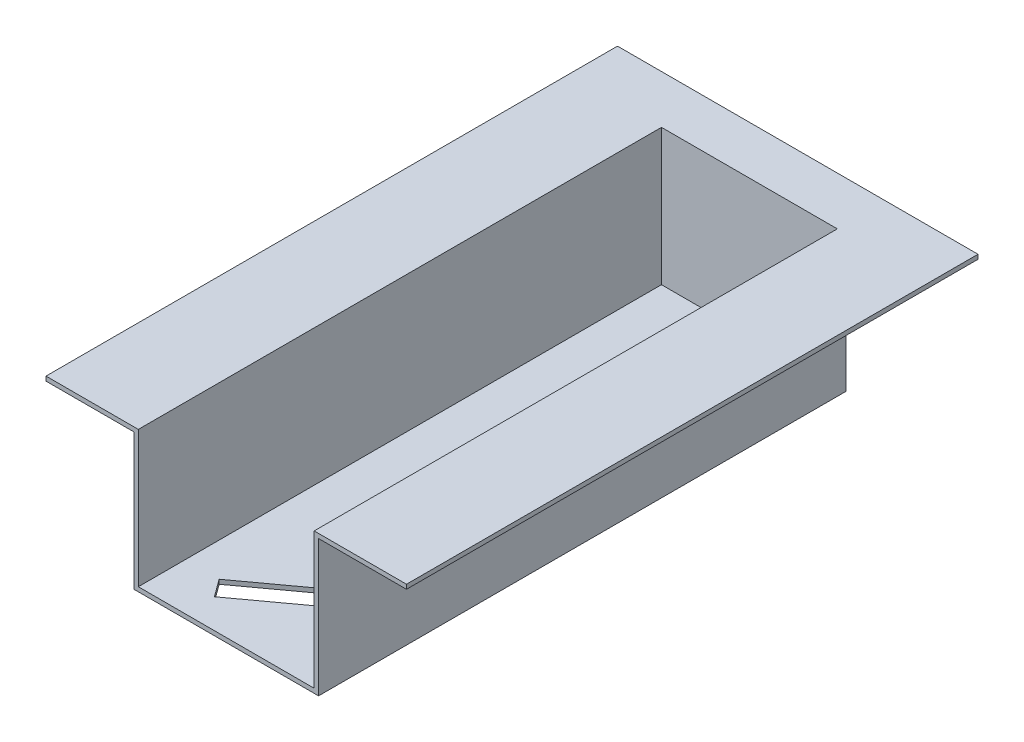
from build123d import *

# Parameters (mm, degrees)
BOSS_EXTRUDE1_DEPTH = 120
SKETCH2_W           = 40
SKETCH2_H           = 31
BOSS_EXTRUDE2_DEPTH = 1
SKETCH3_W           = 82
SKETCH3_H           = 10
BOSS_EXTRUDE3_DEPTH = 1
CUT_EXTRUDE1_REACH  = 132.786


with BuildPart() as part:
    # Sketch1 → Boss-Extrude1 (new body)
    with BuildSketch(Plane.XY):
        Polygon((0, 0), (21, 0), (21, 31), (41, 31), (41, 32), (20, 32), (20, 1), (-20, 1), (-20, 32), (-41, 32), (-41, 31), (-21, 31), (-21, 0), align=None)
    extrude(amount=BOSS_EXTRUDE1_DEPTH)

    # Sketch2 → Boss-Extrude2 (add)
    with BuildSketch(Plane.XY):
        with Locations((0, 16.5)):
            Rectangle(SKETCH2_W, SKETCH2_H)
    extrude(amount=BOSS_EXTRUDE2_DEPTH)

    # Sketch3 → Boss-Extrude3 (add)
    with BuildSketch(Plane(origin=(0, 32, 0), x_dir=(1, 0, 0), z_dir=(0, 1, 0))):
        with Locations((0, 5)):
            Rectangle(SKETCH3_W, SKETCH3_H)
    extrude(amount=-BOSS_EXTRUDE3_DEPTH)

    # Sketch5 → Cut-Extrude1 (cut, up to next)
    with BuildSketch(Plane.XZ, mode=Mode.PRIVATE) as cut_extrude1_sk1:
        Polygon((-12.289999909, 109.324414492), (12.420744589, 91.281648668), (-10.281215872, 60.189833254), (12.420744589, 40.683457553), (-7.320491327, 17.708161471), (-4.023584667, 14.596386717), (17.749369176, 40.683457553), (-5.622021235, 60.189833254), (17.749369176, 93.5089278), (-9.376273607, 113.314952689), align=None)
    cut_extrude1_tool1 = extrude(cut_extrude1_sk1.sketch, amount=-CUT_EXTRUDE1_REACH, mode=Mode.PRIVATE) & part.part
    add(cut_extrude1_tool1.solids().sort_by_distance((0.673866, 0, 101.136403))[0], mode=Mode.SUBTRACT)


solid = part.part
